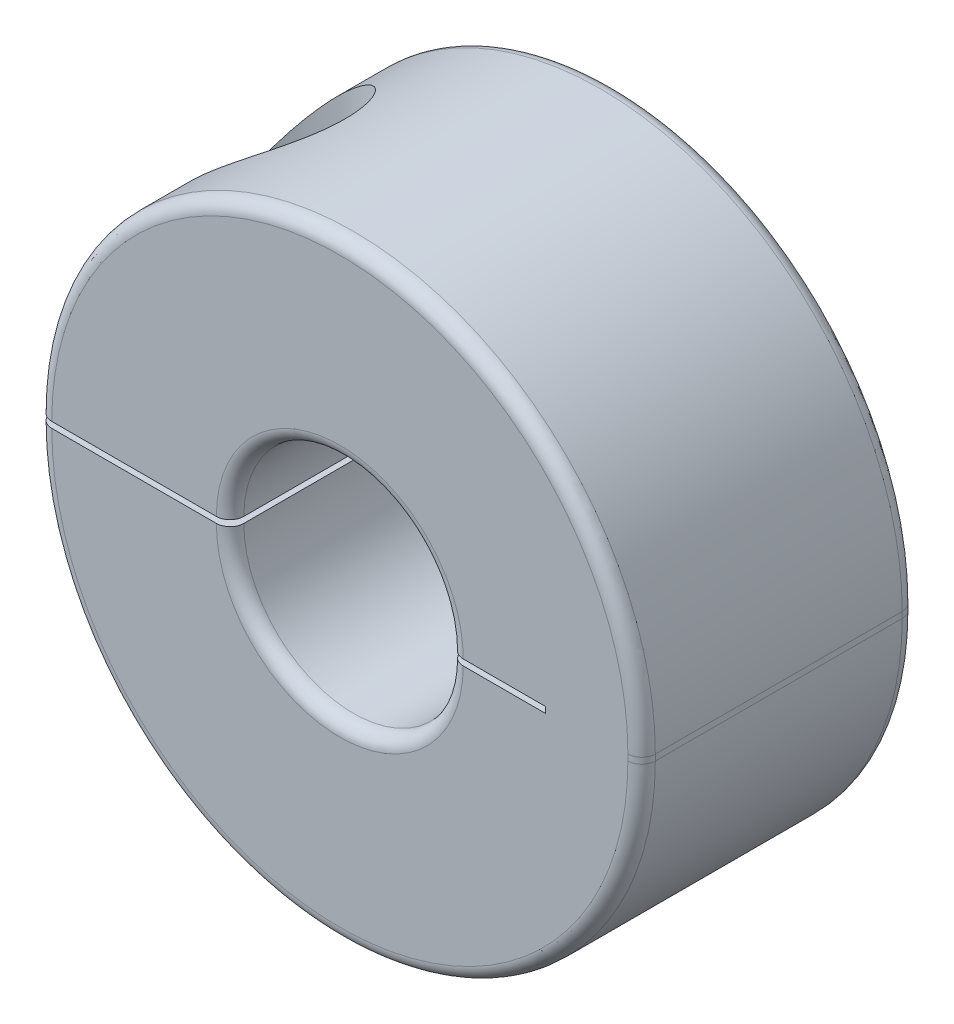
from build123d import *

# Parameters (mm, degrees)
EXTRUDE1_DEPTH     = 3.96875
CUT_EXTRUDE2_DEPTH = 1.4224
FILLET1_R          = 0.396875
FILLET2_R          = 0.396875
CHAMFER2_SIZE      = 0.254


with BuildPart() as part:
    # Sketch1 → Extrude1 (new, symmetric)
    with BuildSketch(Plane.XY):
        with BuildLine():
            Line((-8.73125, 0.0873125), (-3.175, 0.0873125))
            ThreePointArc((-3.175, 0.0873125), (0, 3.2623125), (3.175, 0.0873125))
            Line((3.175, 0.0873125), (5.953125, 0.0873125))
            Line((5.953125, 0.0873125), (5.953125, -0.0873125))
            Line((5.953125, -0.0873125), (3.175, -0.0873125))
            ThreePointArc((3.175, -0.0873125), (0, -3.2623125), (-3.175, -0.0873125))
            Line((-3.175, -0.0873125), (-8.73125, -0.0873125))
            ThreePointArc((-8.73125, -0.0873125), (0, -8.8185625), (8.73125, -0.0873125))
            Line((8.73125, -0.0873125), (8.73125, 0.0873125))
            ThreePointArc((8.73125, 0.0873125), (0, 8.8185625), (-8.73125, 0.0873125))
        make_face()
    extrude(amount=EXTRUDE1_DEPTH, both=True)

    # Sketch4 → Cut-Revolve1 (revolve, cut)
    with BuildSketch(Plane.XY):
        Polygon((-5.953125, 8.8185625), (-3.819525, 8.8185625), (-3.819525, 0.7985125), (-4.530725, 0.7985125), (-4.530725, -8.8185625), (-5.953125, -8.8185625), align=None)
    revolve(axis=Axis((-5.953125, -8.8185625, 0), (0, 1, 0)), mode=Mode.SUBTRACT)

    # Fillet1
    fillet1_edges = [part.edges().sort_by_distance(p)[0] for p in [
        (0, 3.2623125, -3.96875),
        (0, 3.2623125, 3.96875),
        (0, 8.8185625, -3.96875),
        (0, 8.8185625, 3.96875),
        (0, -8.8185625, -3.96875),
        (0, -8.8185625, 3.96875),
        (8.73125, 0, -3.96875),
        (8.73125, 0, 3.96875),
    ]]
    fillet(fillet1_edges, radius=FILLET1_R)

    # Fillet2
    fillet2_edges = [part.edges().sort_by_distance(p)[0] for p in [
        (0, -3.2623125, -3.96875),
        (0, -3.2623125, 3.96875),
    ]]
    fillet(fillet2_edges, radius=FILLET2_R)


with BuildPart() as body_2:
    # Sketch6 → Revolve1 (revolve)
    with BuildSketch(Plane.XY):
        Polygon((-5.953125, 3.6433125), (-3.819525, 3.6433125), (-3.819525, 0.7985125), (-4.530725, 0.7985125), (-4.530725, -4.8910875), (-5.953125, -4.8910875), align=None)
    revolve(axis=Axis((-5.953125, -4.8910875, 0), (0, 1, 0)))

    # Sketch7 → Cut-Extrude2 (cut)
    with BuildSketch(Plane(origin=(0, 3.6433125, 0), x_dir=(-1, 0, 0), z_dir=(0, 1, 0))):
        Polygon((5.953125, -1.313956837), (7.091045, -0.656978418), (7.091045, 0.656978418), (5.953125, 1.313956837), (4.815205, 0.656978418), (4.815205, -0.656978418), align=None)
    extrude(amount=-CUT_EXTRUDE2_DEPTH, mode=Mode.SUBTRACT)

    # Chamfer2
    chamfer2_edges = [body_2.edges().sort_by_distance(p)[0] for p in [
        (-8.086725, 3.6433125, 0),
    ]]
    chamfer(chamfer2_edges, length=CHAMFER2_SIZE)


solid = Compound([part.part, body_2.part])
